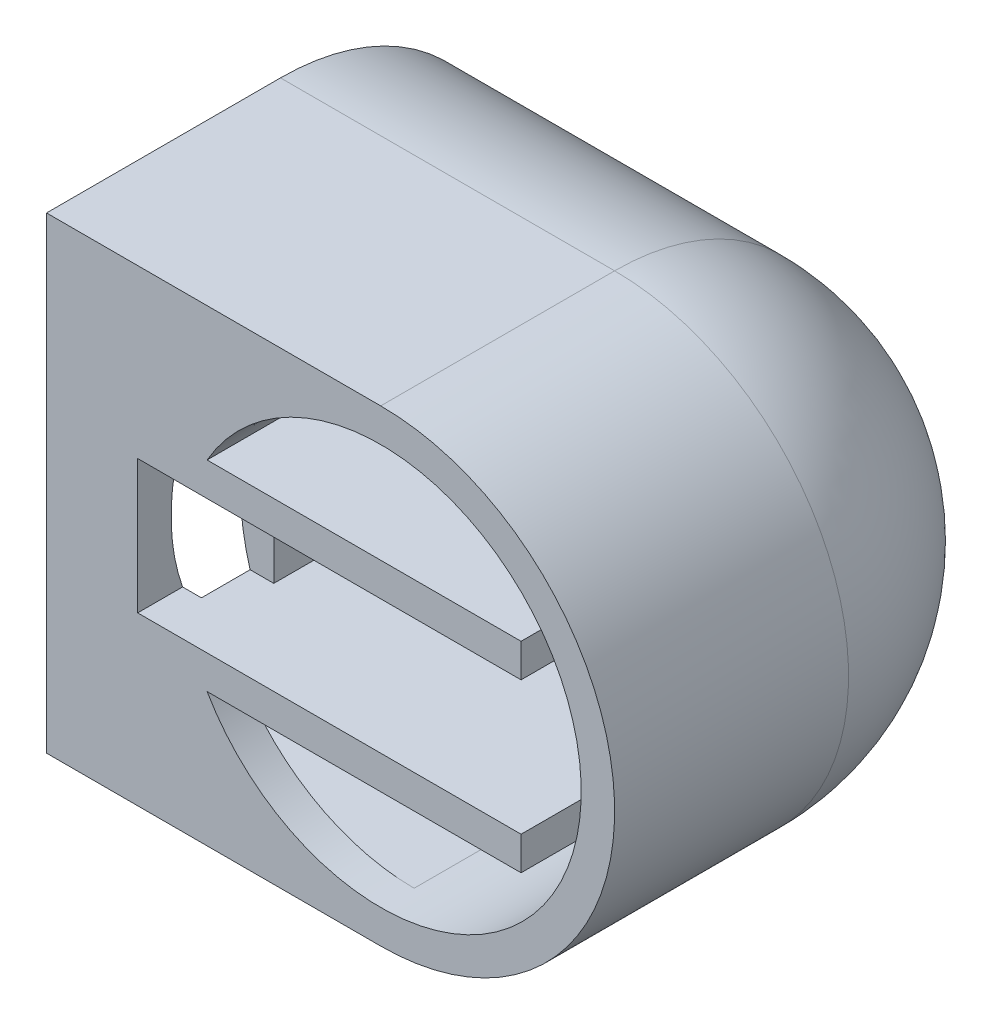
from build123d import *

# Parameters (mm, degrees)
SKETCH3_R                = 35
SKETCH3_R_2              = 30
BOSS_EXTRUDE1_DEPTH      = 50
BOSS_EXTRUDE2_START      = -5
SKETCH4_R                = 30
BOSS_EXTRUDE2_DEPTH      = 5
REVOLVE1_ANGLE           = 90
SKETCH8_R                = 30
CUT_EXTRUDE2_DEPTH       = 5
BOSS_EXTRUDE4_REACH      = 100.362
BOSS_EXTRUDE4_END_RADIUS = 30
BOSS_EXTRUDE5_REACH      = 100.362
BOSS_EXTRUDE18_DEPTH     = 35
SKETCH13_W               = 35
SKETCH13_H               = 5
BOSS_EXTRUDE19_DEPTH     = 50
BOSS_EXTRUDE20_REACH     = 114.583
SKETCH14_W               = 50
SKETCH14_H               = 5
CUT_EXTRUDE4_START       = -25
SKETCH15_R               = 30
CUT_EXTRUDE4_DEPTH       = 25
CUT_EXTRUDE6_DEPTH       = 116.542200083
CUT_EXTRUDE6_DEPTH_BACK  = 40
BOSS_EXTRUDE21_START     = -32
BOSS_EXTRUDE21_DEPTH     = 32
SKETCH20_W               = 6.358964111
SKETCH20_H               = 20
SKETCH20_W_2             = 46
SKETCH20_W_3             = 5
CUT_EXTRUDE7_DEPTH       = 14


# Read off the part's stored shape, not the designer's step: Shell1
with BuildPart() as part:
    # Sketch3 → Boss-Extrude1 (new body)
    with BuildSketch(Plane(origin=(0, 0, 0), x_dir=(0, 0, -1), z_dir=(1, 0, 0))):
        Circle(SKETCH3_R)
        Circle(SKETCH3_R_2, mode=Mode.SUBTRACT)
    extrude(amount=BOSS_EXTRUDE1_DEPTH)

    # Sketch4 → Boss-Extrude2 (add)
    with BuildSketch(Plane(origin=(50, 0, 0), x_dir=(0, 0, -1), z_dir=(1, 0, 0)).offset(BOSS_EXTRUDE2_START)):
        Circle(SKETCH4_R)
    extrude(amount=BOSS_EXTRUDE2_DEPTH)

    # Sketch5 → Revolve1 (revolve)
    with BuildSketch(Plane(origin=(50, 0, 0), x_dir=(0, 0, -1), z_dir=(1, 0, 0))):
        with BuildLine():
            Line((0, -35), (0, 35))
            ThreePointArc((0, 35), (35, 0), (0, -35))
        make_face()
    revolve(axis=Axis((50, -35, 0), (0, -1, 0)), revolution_arc=REVOLVE1_ANGLE)

    # Shell1 outline → Shell1 (revolve, cut)
    with BuildSketch(Plane.YX):
        with BuildLine():
            Line((0, 80), (0, 50))
            Line((0, 50), (30, 50))
            ThreePointArc((30, 50), (21.213203436, 71.213203436), (0, 80))
        make_face()
    revolve(axis=Axis((0, 0, 0), (1, 0, 0)), mode=Mode.SUBTRACT)

    # Sketch8 → Cut-Extrude2 (cut)
    with BuildSketch(Plane.ZY.offset(-45)):
        with Locations(Location((0, 0, 0), (0, 0, 90))):
            Circle(SKETCH8_R)
    extrude(amount=-CUT_EXTRUDE2_DEPTH, mode=Mode.SUBTRACT)

    # Boss-Extrude4: up to this sphere (the profile starts inside it)
    boss_extrude4_end = Location((50, 0, 0)) * Sphere(BOSS_EXTRUDE4_END_RADIUS, mode=Mode.PRIVATE)
    # Sketch7 → Boss-Extrude4 (add, up to the surface)
    with BuildSketch(Plane.XY, mode=Mode.PRIVATE) as boss_extrude4_sk1:
        Polygon((65.435214922, 10), (65.435214922, 0), (65.435214922, -10), (78.284271247, -10), (78.284271247, 10), align=None)
    boss_extrude4_tool1 = extrude(boss_extrude4_sk1.sketch, amount=-BOSS_EXTRUDE4_REACH, mode=Mode.PRIVATE) & boss_extrude4_end
    add(boss_extrude4_tool1.solids().sort_by_distance((71.859743, 0, 0))[0])

    # Sketch10 → Boss-Extrude5 (add, up to next)
    with BuildSketch(Plane.XY, mode=Mode.PRIVATE) as boss_extrude5_sk1:
        with BuildLine():
            ThreePointArc((50, 35), (15, 0), (50, -35))
            Line((50, -35), (50, -30))
            ThreePointArc((50, -30), (20, 0), (50, 30))
            Line((50, 30), (50, 35))
        make_face()
    boss_extrude5_tool1 = extrude(boss_extrude5_sk1.sketch, amount=BOSS_EXTRUDE5_REACH, mode=Mode.PRIVATE) - part.part
    add(boss_extrude5_tool1.solids().sort_by_distance((49.217376, 32.5, 0))[0])

    # Sketch12 → Boss-Extrude18 (add)
    with BuildSketch(Plane.XY):
        with BuildLine():
            ThreePointArc((78.284271247, 10), (80, 0), (78.284271247, -10))
            ThreePointArc((78.284271247, -10), (67.320508076, -24.494897428), (50, -30))
            Line((50, -30), (50, -35))
            ThreePointArc((50, -35), (85, 0), (50, 35))
            Line((50, 35), (50, 30))
            ThreePointArc((50, 30), (67.320508076, 24.494897428), (78.284271247, 10))
        make_face()
    extrude(amount=BOSS_EXTRUDE18_DEPTH)

    # Sketch13 → Boss-Extrude19 (add)
    with BuildSketch(Plane.ZY.offset(-50)):
        with Locations((17.5, -32.5)):
            Rectangle(SKETCH13_W, SKETCH13_H)
        with Locations((17.5, 32.5)):
            Rectangle(SKETCH13_W, SKETCH13_H)
    extrude(amount=BOSS_EXTRUDE19_DEPTH)

    # Boss-Extrude20: up to this face of the body (flat: up to its plane)
    boss_extrude20_end = Plane(part.part.faces().sort_by_distance((25, 30, 26.513878189))[0])
    # Sketch14 → Boss-Extrude20 (add, up to the picked face)
    with BuildSketch(Plane(origin=(0, -30, 0), x_dir=(1, 0, 0), z_dir=(0, 1, 0)), mode=Mode.PRIVATE) as boss_extrude20_sk1:
        with Locations((25, -32.5)):
            Rectangle(SKETCH14_W, SKETCH14_H)
    boss_extrude20_tool1 = split(extrude(boss_extrude20_sk1.sketch, amount=BOSS_EXTRUDE20_REACH, mode=Mode.PRIVATE), bisect_by=boss_extrude20_end, keep=Keep.BOTH, mode=Mode.PRIVATE)
    add(boss_extrude20_tool1.solids().sort_by(Axis((25, -30, 32.5), (0, 1, 0)))[0])

    # Sketch15 → Cut-Extrude4 (cut)
    with BuildSketch(Plane.XY.offset(35).offset(CUT_EXTRUDE4_START)):
        with Locations(Location((50, 0, 0), (0, 0, 109.471220634))):
            Circle(SKETCH15_R)
    extrude(amount=CUT_EXTRUDE4_DEPTH, mode=Mode.SUBTRACT)

    # Sketch16 → Cut-Extrude6 (cut, two sides: drawn at the far end of the back side and taken through both)
    with BuildSketch(Plane.XY.offset(35).offset(-CUT_EXTRUDE6_DEPTH_BACK)):
        with BuildLine():
            Line((21.715728753, 10), (20, 10))
            Line((20, 10), (20, 0))
            ThreePointArc((20, 0), (20.43204321, 5.073059362), (21.715728753, 10))
        make_face()
        with BuildLine():
            ThreePointArc((21.715728753, -10), (20.43204321, -5.073059362), (20, 0))
            Line((20, 0), (20, -10))
            Line((20, -10), (21.715728753, -10))
        make_face()
    extrude(amount=CUT_EXTRUDE6_DEPTH + CUT_EXTRUDE6_DEPTH_BACK, mode=Mode.SUBTRACT)

    # Sketch16<17> → Boss-Extrude21 (add)
    with BuildSketch(Plane.XY.offset(35).offset(BOSS_EXTRUDE21_START)):
        with BuildLine():
            ThreePointArc((24.019237886, 15), (22.752551286, 12.552949398), (21.715728753, 10))
            Line((21.715728753, 10), (66, 10))
            Line((66, 10), (66, -10))
            Line((66, -10), (21.715728753, -10))
            ThreePointArc((21.715728753, -10), (22.752551286, -12.552949398), (24.019237886, -15))
            Line((24.019237886, -15), (71, -15))
            Line((71, -15), (71, 15))
            Line((71, 15), (24.019237886, 15))
        make_face()
    extrude(amount=BOSS_EXTRUDE21_DEPTH)

    # Sketch20 → Cut-Extrude7 (cut)
    with BuildSketch(Plane.XY.offset(35)):
        with Locations((16.820517945, 0)):
            Rectangle(SKETCH20_W, SKETCH20_H)
        with Locations((43, 0)):
            Rectangle(SKETCH20_W_2, SKETCH20_H)
        with Locations((68.5, 0)):
            Rectangle(SKETCH20_W_3, SKETCH20_H)
    extrude(amount=-CUT_EXTRUDE7_DEPTH, mode=Mode.SUBTRACT)


solid = part.part
